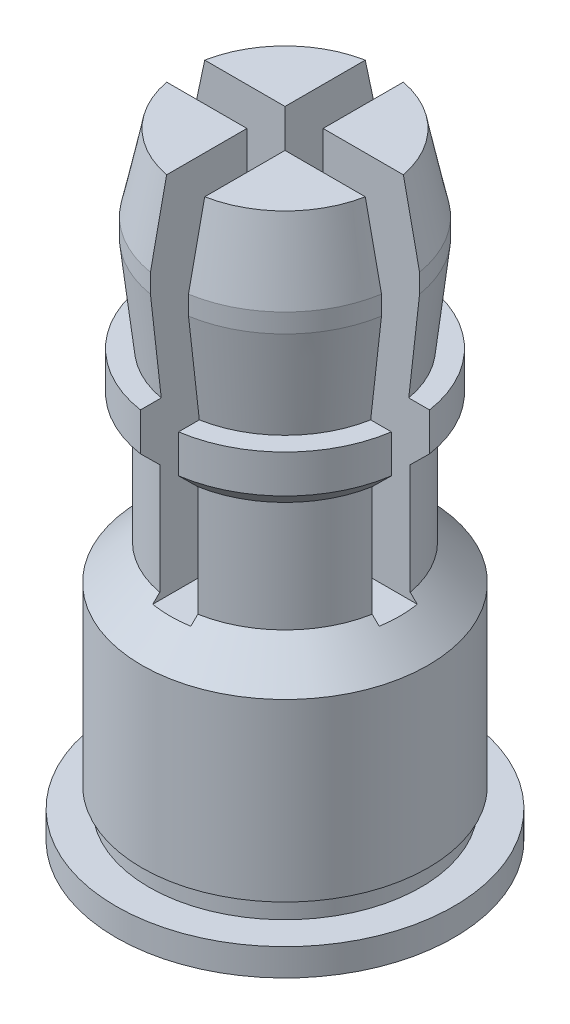
from build123d import *

# Parameters (mm, degrees)
SLITCUTSKE_W     = 5.33220965
SLITCUTSKE_H     = 0.7155
SLITCUT_DEPTH    = 6.8582
SLITCUTPAT_COUNT = 2
SLITCUTPAT_ANGLE = 90


with BuildPart() as part:
    # BodySke → Body (revolve)
    with BuildSketch(Plane.XY):
        Polygon((2.5555, 0.51), (2.5555, 0.8925), (2.69, 0.8925), (2.69, 4.18905), (2.02725, 4.8518), (2.02725, 6.92675), (2.385, 7.2845), (2.385, 8), (2, 8), (2.2, 9.79), (2.2, 10.148), (1.9, 11.58), (0, 11.58), (0, 0), (3.175, 0), (3.175, 0.51), align=None)
    revolve(axis=Axis((0, 0, 0), (0, 1, 0)))

    # SlitCutSke → SlitCut (cut)
    with BuildSketch(Plane(origin=(0, 11.58, 0), x_dir=(-1, 0, 0), z_dir=(0, 1, 0))):
        Rectangle(SLITCUTSKE_W, SLITCUTSKE_H)
    slitcut = extrude(amount=-SLITCUT_DEPTH, mode=Mode.SUBTRACT)

    # SlitCutPat: SlitCut ×2 about axis
    slitcutpat_axis = Axis((0, 0, 0), (0, 1, 0))
    for i in range(1, SLITCUTPAT_COUNT):
        add(slitcut.rotate(slitcutpat_axis, i * SLITCUTPAT_ANGLE / (SLITCUTPAT_COUNT - 1)), mode=Mode.SUBTRACT)


solid = part.part
